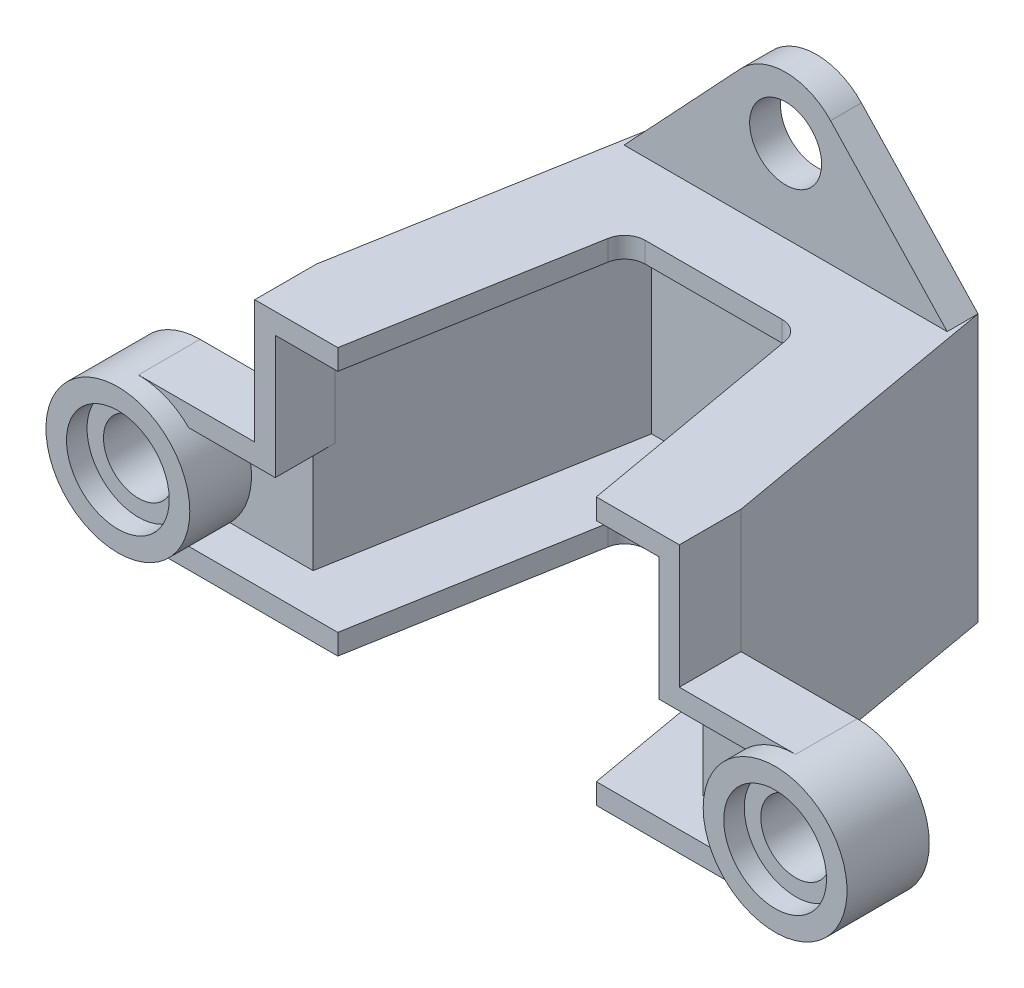
from build123d import *

# Parameters (mm, degrees)
ESTRUSIONE_ESTRUSIONE1_DEPTH = 3
SCHIZZO2_W                   = 20.66
SCHIZZO2_H                   = 13
ESTRUSIONE_ESTRUSIONE2_DEPTH = 14
TAGLIO_ESTRUSIONE1_DEPTH     = 25.91345219
SVUOTA1_T                    = -1
SCHIZZO4_R                   = 3.5
ESTRUSIONE_ESTRUSIONE3_DEPTH = 4
SCHIZZO5_R                   = 2.5
TAGLIO_ESTRUSIONE2_DEPTH     = 1
SCHIZZO6_R                   = 1.7
TAGLIO_ESTRUSIONE3_DEPTH     = 28.728326671
ESTRUSIONE_ESTRUSIONE4_DEPTH = 1.5
SCHIZZO8_R                   = 1.75
TAGLIO_ESTRUSIONE4_DEPTH     = 31.677517827
SCHIZZO9_R                   = 0.8
TAGLIO_ESTRUSIONE5_DEPTH     = 1.5
TAGLIO_ESTRUSIONE6_DEPTH     = 32.238759578
RACCORDO1_R                  = 1
SPECCHIA12_START             = 9
SPECCHIA12_DEPTH             = 1
RACCORDO2_R                  = 1
SPECCHIA15_START             = 9
SPECCHIA15_DEPTH             = 1
SCHIZZO12_R                  = 0.8
ESTRUSIONE_ESTRUSIONE5_DEPTH = 1.5
TAGLIO_ESTRUSIONE7_START     = -1
SCHIZZO13_R                  = 2.5
TAGLIO_ESTRUSIONE7_DEPTH     = 1


# Read off the part's stored shape, not the designer's step: Specchia12, Specchia15
with BuildPart() as part:
    # Schizzo1 → Estrusione-Estrusione1 (new body)
    with BuildSketch(Plane.XY):
        Polygon((-15.99, 4), (-10.33, 4), (-10.33, 10), (10.33, 10), (10.33, 4), (15.99, 4), (15.99, -3), (-15.99, -3), align=None)
    extrude(amount=ESTRUSIONE_ESTRUSIONE1_DEPTH)

    # Schizzo2 → Estrusione-Estrusione2 (add)
    with BuildSketch(Plane.XY):
        with Locations((0, 3.5)):
            Rectangle(SCHIZZO2_W, SCHIZZO2_H)
    extrude(amount=-ESTRUSIONE_ESTRUSIONE2_DEPTH)

    # Schizzo3 → Taglio-Estrusione1 (cut, through all)
    with BuildSketch(Plane(origin=(0, 10, 0), x_dir=(1, 0, 0), z_dir=(0, 1, 0))):
        Polygon((-10.33, 0), (-7.86142227, 14), (-10.33, 14), align=None)
    taglio_estrusione1 = extrude(amount=-TAGLIO_ESTRUSIONE1_DEPTH, mode=Mode.SUBTRACT)

    # Specchia1: Taglio-Estrusione1 across plane
    add(taglio_estrusione1.mirror(Plane(origin=(0, 0, 0), x_dir=(0, 0, 1), z_dir=(1, 0, 0))), mode=Mode.SUBTRACT)

    # Svuota1
    svuota1_openings = [part.faces().sort_by_distance(p)[0] for p in [
        (0, 2.81654304, 3),
    ]]
    offset(amount=SVUOTA1_T, openings=svuota1_openings, kind=Kind.INTERSECTION)

    # Schizzo4 → Estrusione-Estrusione3 (add)
    with BuildSketch(Plane.XY):
        with Locations(Location((-15.99, 0.5, 0), (0, 0, 270))):
            Circle(SCHIZZO4_R)
    estrusione_estrusione3 = extrude(amount=ESTRUSIONE_ESTRUSIONE3_DEPTH)

    # Schizzo5 → Taglio-Estrusione2 (cut)
    with BuildSketch(Plane.XY.offset(4)):
        with Locations((-15.99, 0.5)):
            Circle(SCHIZZO5_R)
    taglio_estrusione2 = extrude(amount=-TAGLIO_ESTRUSIONE2_DEPTH, mode=Mode.SUBTRACT)

    # Schizzo6 → Taglio-Estrusione3 (cut, through all)
    with BuildSketch(Plane.XY.offset(3)):
        with Locations((-15.99, 0.5)):
            Circle(SCHIZZO6_R)
    taglio_estrusione3 = extrude(amount=-TAGLIO_ESTRUSIONE3_DEPTH, mode=Mode.SUBTRACT)

    # Specchia2: Estrusione-Estrusione3, Taglio-Estrusione2, Taglio-Estrusione3 across plane
    add(estrusione_estrusione3.mirror(Plane(origin=(0, 0, 0), x_dir=(0, 0, 1), z_dir=(1, 0, 0))))
    add(taglio_estrusione2.mirror(Plane(origin=(0, 0, 0), x_dir=(0, 0, 1), z_dir=(1, 0, 0))), mode=Mode.SUBTRACT)
    add(taglio_estrusione3.mirror(Plane(origin=(0, 0, 0), x_dir=(0, 0, 1), z_dir=(1, 0, 0))), mode=Mode.SUBTRACT)

    # Schizzo7 → Estrusione-Estrusione4 (add)
    with BuildSketch(Plane(origin=(0, 0, -14), x_dir=(-1, 0, 0), z_dir=(0, 0, -1))):
        with BuildLine():
            Line((-7.86142227, 10), (-2.188751242, 16.051674439))
            ThreePointArc((-2.188751242, 16.051674439), (0, 17), (2.188751242, 16.051674439))
            Line((2.188751242, 16.051674439), (7.86142227, 10))
            Line((7.86142227, 10), (-7.86142227, 10))
        make_face()
    extrude(amount=-ESTRUSIONE_ESTRUSIONE4_DEPTH)

    # Schizzo8 → Taglio-Estrusione4 (cut, through all)
    with BuildSketch(Plane.XY.offset(-12.5)):
        with Locations((0, 14)):
            Circle(SCHIZZO8_R)
    extrude(amount=-TAGLIO_ESTRUSIONE4_DEPTH, mode=Mode.SUBTRACT)

    # Schizzo9 → Taglio-Estrusione5 (cut)
    with BuildSketch(Plane(origin=(0, 0, -14), x_dir=(-1, 0, 0), z_dir=(0, 0, -1))):
        with Locations((-5.36142227, 7.5)):
            Circle(SCHIZZO9_R)
    taglio_estrusione5 = extrude(amount=-TAGLIO_ESTRUSIONE5_DEPTH, mode=Mode.SUBTRACT)

    # Specchia5: Taglio-Estrusione5 across plane
    add(taglio_estrusione5.mirror(Plane(origin=(0, 0, 0), x_dir=(0, 0, 1), z_dir=(1, 0, 0))), mode=Mode.SUBTRACT)

    # Schizzo10 → Taglio-Estrusione6 (cut, through all)
    with BuildSketch(Plane.XZ.offset(3)):
        Polygon((-6.289561189, 3), (-4.17363742, -9), (4.17363742, -9), (6.289561189, 3), align=None)
    extrude(amount=-TAGLIO_ESTRUSIONE6_DEPTH, mode=Mode.SUBTRACT)

    # Raccordo1
    raccordo1_edges = [part.edges().sort_by_distance(p)[0] for p in [
        (-4.17363742, -2.5, -9),
    ]]
    fillet(raccordo1_edges, radius=RACCORDO1_R)

    # Specchia12 outline → Specchia12 (add)
    with BuildSketch(Plane(origin=(0, 0, 0), x_dir=(1, 0, 0), z_dir=(0, 1, 0)).offset(SPECCHIA12_START)):
        with BuildLine():
            ThreePointArc((-4.319345542, 8.173648178), (-3.977325399, 8.766044443), (-3.334537789, 9))
            Line((-3.334537789, 9), (-4.17363742, 9))
            Line((-4.17363742, 9), (-4.319345542, 8.173648178))
        make_face()
    extrude(amount=SPECCHIA12_DEPTH)

    # Raccordo2
    raccordo2_edges = [part.edges().sort_by_distance(p)[0] for p in [
        (4.17363742, -2.5, -9),
    ]]
    fillet(raccordo2_edges, radius=RACCORDO2_R)

    # Specchia15 outline → Specchia15 (add)
    with BuildSketch(Plane(origin=(0, 0, 0), x_dir=(1, 0, 0), z_dir=(0, 1, 0)).offset(SPECCHIA15_START)):
        with BuildLine():
            ThreePointArc((3.334537789, 9), (3.977325399, 8.766044443), (4.319345542, 8.173648178))
            Line((4.319345542, 8.173648178), (4.17363742, 9))
            Line((4.17363742, 9), (3.334537789, 9))
        make_face()
    extrude(amount=SPECCHIA15_DEPTH)

    # Schizzo12 → Estrusione-Estrusione5 (add)
    with BuildSketch(Plane(origin=(0, 0, -14), x_dir=(-1, 0, 0), z_dir=(0, 0, -1))):
        with BuildLine():
            Line((-7.86142227, -3), (-2.188751242, -9.051674439))
            ThreePointArc((-2.188751242, -9.051674439), (0, -10), (2.188751242, -9.051674439))
            Line((2.188751242, -9.051674439), (7.86142227, -3))
            Line((7.86142227, -3), (-7.86142227, -3))
        make_face()
        with Locations((0, -4.5)):
            Circle(SCHIZZO12_R, mode=Mode.SUBTRACT)
    extrude(amount=-ESTRUSIONE_ESTRUSIONE5_DEPTH)

    # Schizzo13 → Taglio-Estrusione7 (cut)
    with BuildSketch(Plane(origin=(0, 0, 0), x_dir=(-1, 0, 0), z_dir=(0, 0, -1)).offset(TAGLIO_ESTRUSIONE7_START)):
        with Locations((-15.99, 0.5)):
            Circle(SCHIZZO13_R)
    taglio_estrusione7 = extrude(amount=TAGLIO_ESTRUSIONE7_DEPTH, mode=Mode.SUBTRACT)

    # Specchia16: Taglio-Estrusione7 across plane
    add(taglio_estrusione7.mirror(Plane(origin=(0, 0, 0), x_dir=(0, 0, 1), z_dir=(1, 0, 0))), mode=Mode.SUBTRACT)


solid = part.part
